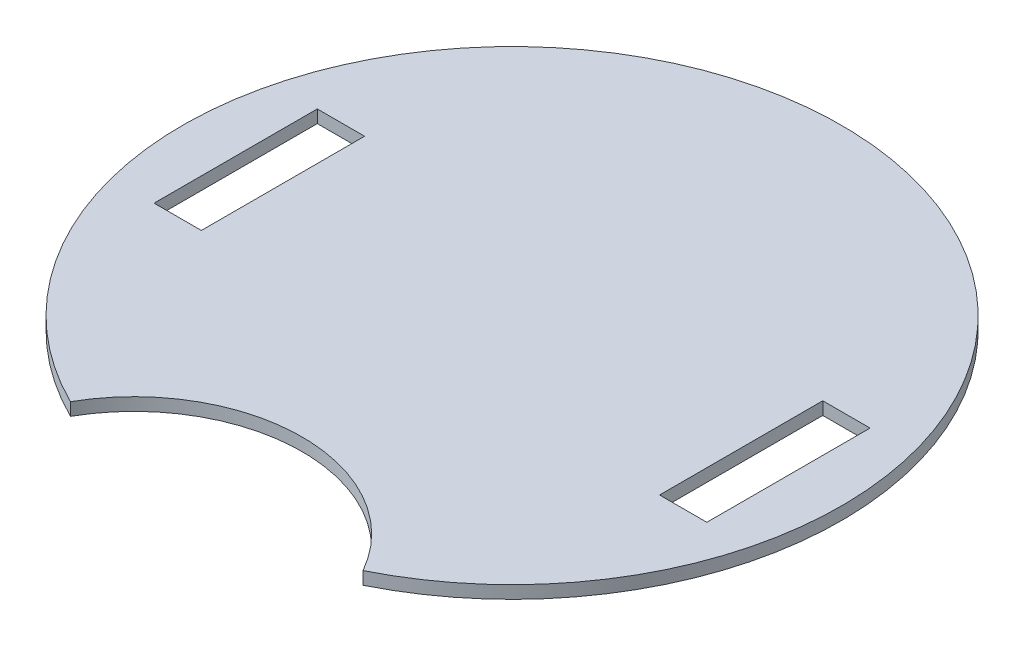
from build123d import *

# Parameters (mm, degrees)
BOSS_EXTRUDE1_DEPTH = 2.9
SKETCH2_W           = 10.76
SKETCH2_H           = 37.139097212
CUT_EXTRUDE1_DEPTH  = 107.105654892


with BuildPart() as part:
    # Sketch1 → Boss-Extrude1 (new body)
    with BuildSketch(Plane(origin=(0, 0, 0), x_dir=(1, 0, 0), z_dir=(0, 1, 0))):
        with BuildLine():
            ThreePointArc((33.29110537, -67.206415641), (0, 75), (-33.29110537, -67.206415641))
            ThreePointArc((-33.29110537, -67.206415641), (0, -47.791616815), (33.29110537, -67.206415641))
        make_face()
    extrude(amount=BOSS_EXTRUDE1_DEPTH)

    # Sketch2 → Cut-Extrude1 (cut, through all)
    with BuildSketch(Plane(origin=(0, 2.9, 0), x_dir=(1, 0, 0), z_dir=(0, 1, 0))):
        with Locations((-57.517491988, 0)):
            Rectangle(SKETCH2_W, SKETCH2_H)
        with Locations((57.517491988, 0)):
            Rectangle(SKETCH2_W, SKETCH2_H)
    extrude(amount=-CUT_EXTRUDE1_DEPTH, mode=Mode.SUBTRACT)


solid = part.part
